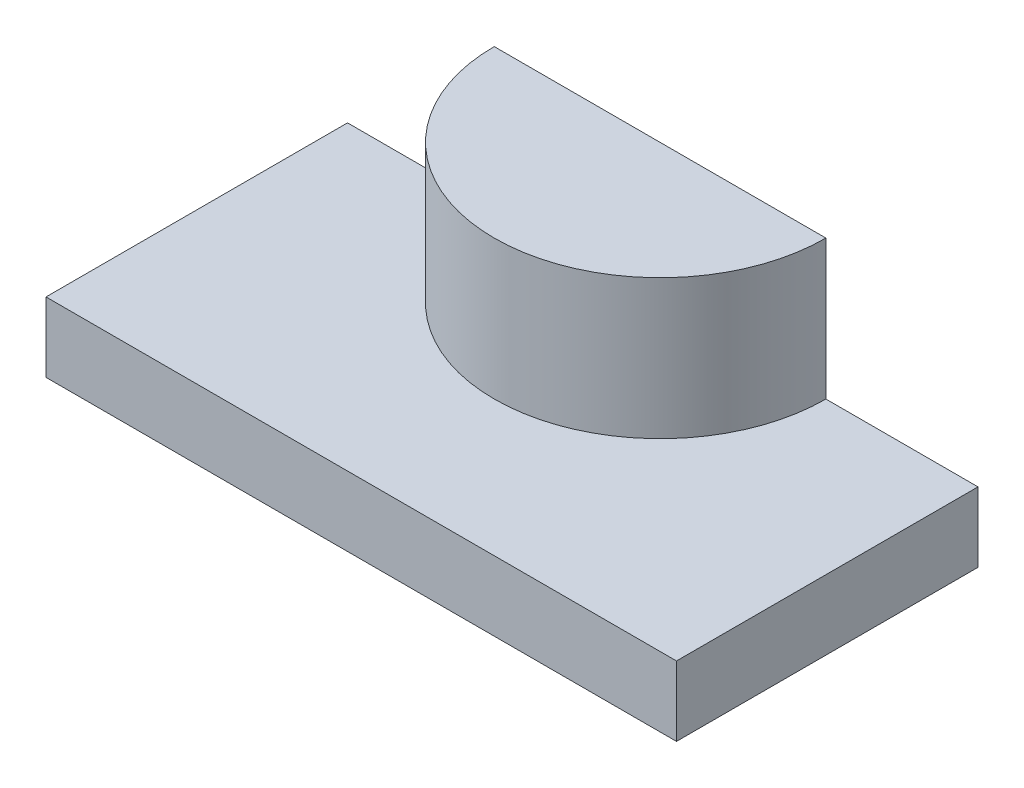
from build123d import *

# Parameters (mm, degrees)
SKETCH_1_W      = 90.450741223
SKETCH_1_H      = 43.255156446
EXTRUDE_1_DEPTH = 10
EXTRUDE_2_DEPTH = 20


with BuildPart() as part:
    # 草图1 → 凸台-拉伸1 (new body)
    with BuildSketch(Plane(origin=(0, 0, 0), x_dir=(1, 0, 0), z_dir=(0, 1, 0))):
        with Locations((45.225370612, 21.627578223)):
            Rectangle(SKETCH_1_W, SKETCH_1_H)
    extrude(amount=EXTRUDE_1_DEPTH)

    # 草图2 → 凸台-拉伸2 (add)
    with BuildSketch(Plane(origin=(0, 10, 0), x_dir=(1, 0, 0), z_dir=(0, 1, 0))):
        with BuildLine():
            Line((68.630258788, 43.255156446), (21.047365446, 43.255156446))
            ThreePointArc((21.047365446, 43.255156446), (44.838812117, 19.463709775), (68.630258788, 43.255156446))
        make_face()
    extrude(amount=EXTRUDE_2_DEPTH)


solid = part.part
